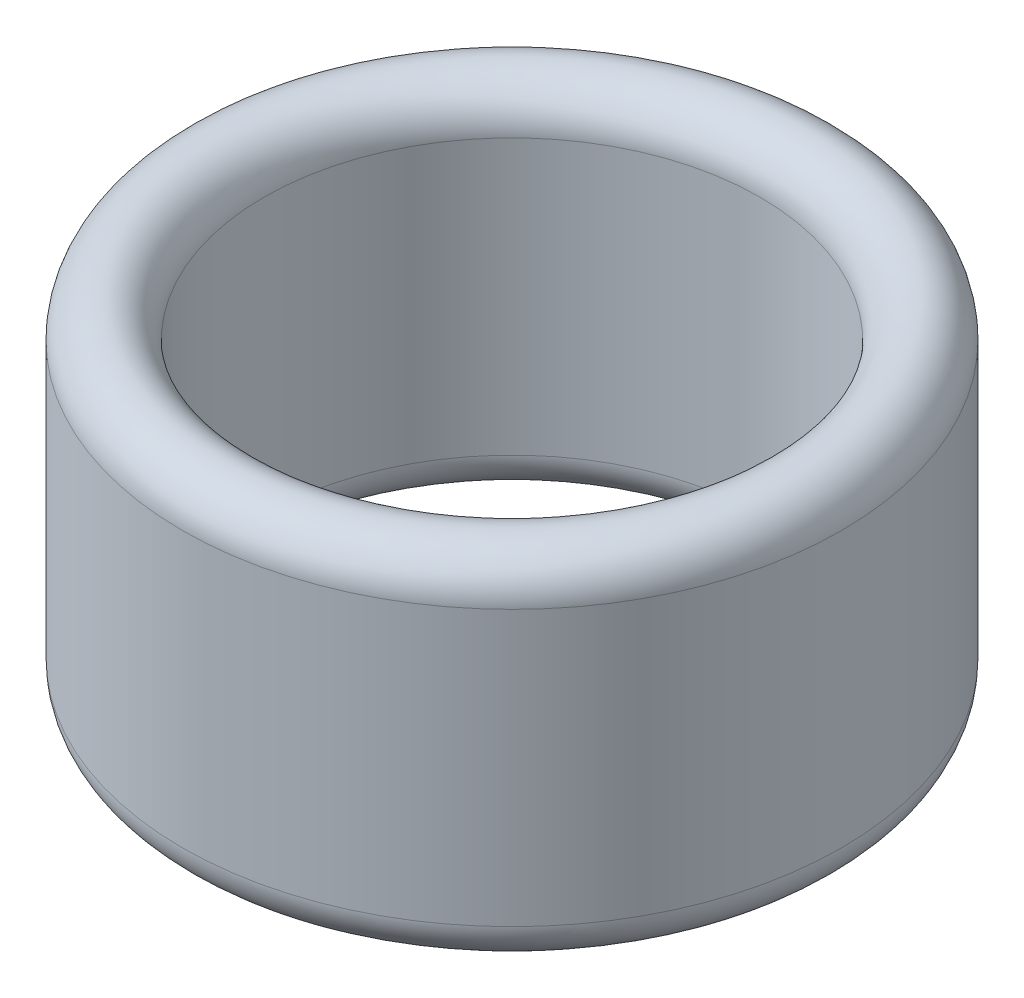
from build123d import *

# Parameters (mm, degrees)
SKETCH1_R           = 3.5941
BOSS_EXTRUDE1_DEPTH = 3.8862
SKETCH2_R           = 2.7051
CUT_EXTRUDE1_DEPTH  = 3.8862
FILLET1_R           = 0.4445
FILLET2_R           = 0.4445


with BuildPart() as part:
    # Sketch1 → Boss-Extrude1 (new body)
    with BuildSketch(Plane(origin=(0, 0, 0), x_dir=(1, 0, 0), z_dir=(0, 1, 0))):
        with Locations(Location((0, 0, 0), (0, 0, 90))):
            Circle(SKETCH1_R)
    extrude(amount=BOSS_EXTRUDE1_DEPTH)

    # Sketch2 → Cut-Extrude1 (cut)
    with BuildSketch(Plane(origin=(0, 3.8862, 0), x_dir=(1, 0, 0), z_dir=(0, 1, 0))):
        with Locations(Location((0, 0, 0), (0, 0, 270))):
            Circle(SKETCH2_R)
    extrude(amount=-CUT_EXTRUDE1_DEPTH, mode=Mode.SUBTRACT)

    # Fillet1
    fillet1_edges = [part.edges().sort_by_distance(p)[0] for p in [
        (0, 3.8862, 3.5941),
        (0, 3.8862, -2.7051),
    ]]
    fillet(fillet1_edges, radius=FILLET1_R - 0.0001)  # a hair under: the kernel refuses the full size

    # Fillet2
    fillet2_edges = [part.edges().sort_by_distance(p)[0] for p in [
        (0, 0, 3.5941),
        (0, 0, -2.7051),
    ]]
    fillet(fillet2_edges, radius=FILLET2_R - 0.0001)  # a hair under: the kernel refuses the full size


solid = part.part
